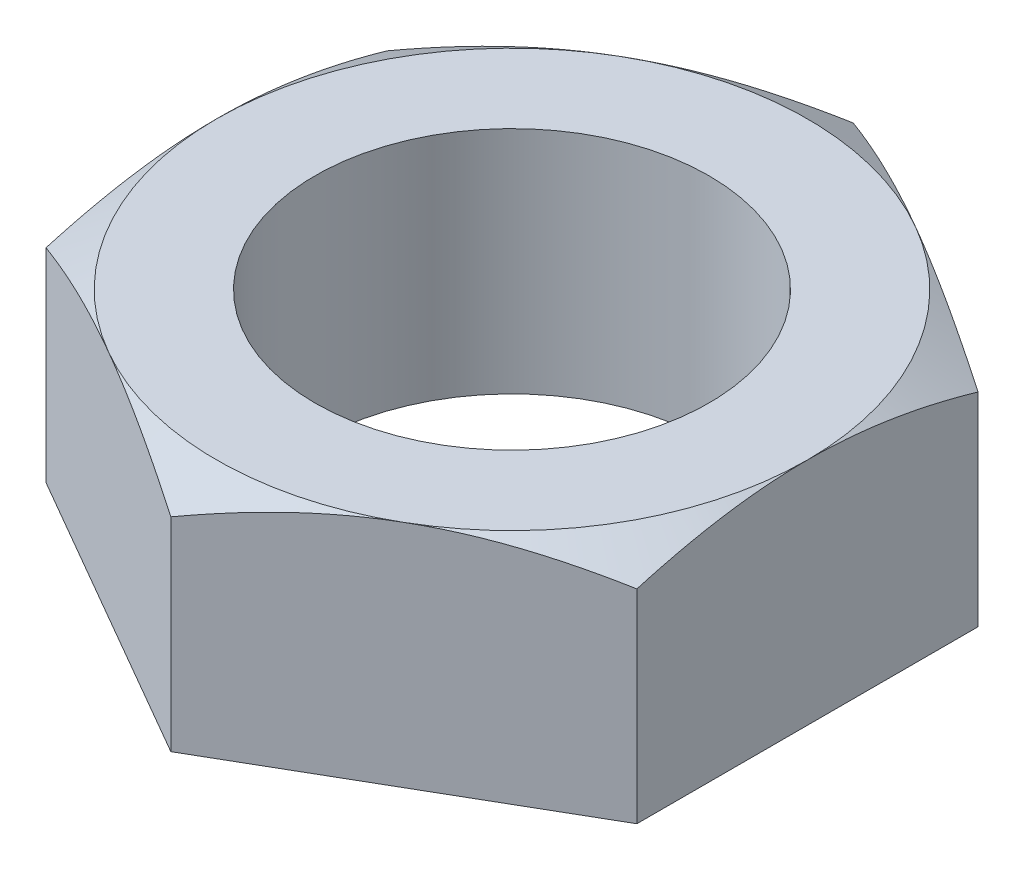
from build123d import *

# Parameters (mm, degrees)
SKETCH1_R           = 4.7625
BOSS_EXTRUDE1_DEPTH = 2.778125
SKETCH5_OUTSIDE_W   = 66.676
SKETCH5_OUTSIDE_H   = 68.886
SKETCH5_OUTSIDE_R   = 7.14375
CUT_EXTRUDE2_DEPTH  = 13.245378593
CUT_EXTRUDE2_DRAFT  = -60


with BuildPart() as part:
    # Sketch1 → Boss-Extrude1 (new, symmetric)
    with BuildSketch(Plane(origin=(0, 0, 0), x_dir=(1, 0, 0), z_dir=(0, 1, 0))):
        Polygon((-7.14375, 4.124445986), (-7.14375, -4.124445986), (0, -8.248891971), (7.14375, -4.124445986), (7.14375, 4.124445986), (0, 8.248891971), align=None)
        Circle(SKETCH1_R, mode=Mode.SUBTRACT)
    extrude(amount=BOSS_EXTRUDE1_DEPTH, both=True)


with BuildPart() as cut_extrude2_tool:
    # Sketch5 outside → Cut-Extrude2 (with draft: the straight prism first)
    with BuildSketch(Plane(origin=(0, 2.778125, 0), x_dir=(1, 0, 0), z_dir=(0, 1, 0))):
        Rectangle(SKETCH5_OUTSIDE_W, SKETCH5_OUTSIDE_H)
        Circle(SKETCH5_OUTSIDE_R, mode=Mode.SUBTRACT)
    extrude(amount=-CUT_EXTRUDE2_DEPTH)
    # Cut-Extrude2: the draft: its side faces are tilted about the plane it starts from
    cut_extrude2_sides = [cut_extrude2_tool.faces().sort_by_distance(p)[0] for p in [
        (0, -3.844564296, 34.443),
        (33.338, -3.844564296, 0),
        (0, -3.844564296, -34.443),
        (-33.338, -3.844564296, 0),
        (-7.14375, -3.844564296, 0),
    ]]
    draft(cut_extrude2_sides, Plane(origin=(0, 2.778125, 0), x_dir=(1, 0, 0), z_dir=(0, 1, 0)), CUT_EXTRUDE2_DRAFT)


with BuildPart() as part_1:
    add(part.part)

    # Cut-Extrude2: cut by cut_extrude2_tool
    add(cut_extrude2_tool.part, mode=Mode.SUBTRACT)


solid = part_1.part
